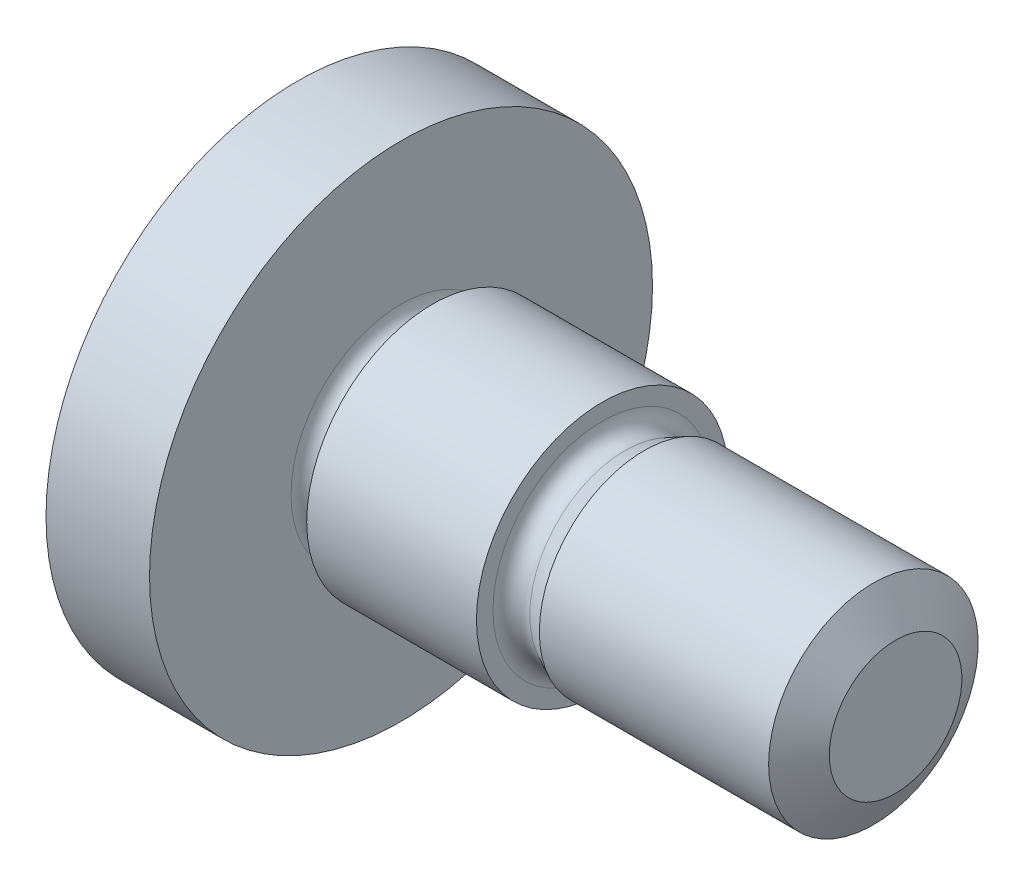
from build123d import *

# Parameters (mm, degrees)
WYTNIJ_WYCI_GNI_CIE1_DEPTH = 3
ZAOKR_GLENIE2_R            = 0.375


with BuildPart() as part:
    # Szkic1 → Obrót1 (revolve)
    with BuildSketch(Plane.XY, mode=Mode.PRIVATE) as obr_t1_sk:
        Polygon((0, 0), (0, 5.082013072), (0.53, 6), (3, 6), (3, 2.25), (3.75, 2.25), (3.75, 3), (7.8, 3), (7.8, 2), (8.8, 2.5), (14.27, 2.5), (14.8, 1.582013072), (14.8, 0), align=None)
    revolve(obr_t1_sk.sketch.rotate(Axis((0, 0, 0), (1, 0, 0)), 90), axis=Axis((0, 0, 0), (1, 0, 0)))

    # Szkic2 → Wytnij-wyciągnięcie1 (cut)
    with BuildSketch(Plane.ZY):
        Polygon((0, -1.732050808), (1.5, -0.866025404), (1.5, 0.866025404), (0, 1.732050808), (-1.5, 0.866025404), (-1.5, -0.866025404), align=None)
    extrude(amount=-WYTNIJ_WYCI_GNI_CIE1_DEPTH, mode=Mode.SUBTRACT)

    # Szkic3 → Wycięcie-obrót1 (revolve, cut)
    with BuildSketch(Plane.XY, mode=Mode.PRIVATE) as wyci_cie_obr_t1_sk:
        Polygon((3, 0), (3, 1.732050808), (3.807668556, 0), align=None)
    revolve(wyci_cie_obr_t1_sk.sketch.rotate(Axis((-0.90277096, 0, 0), (1, 0, 0)), 90), axis=Axis((-0.90277096, 0, 0), (1, 0, 0)), mode=Mode.SUBTRACT)

    # Zaokrąglenie2
    zaokr_glenie2_edges = [part.edges().sort_by_distance(p)[0] for p in [
        (7.8, 0, -2),
        (3.75, 0, -2.25),
        (3, 0, -2.25),
    ]]
    fillet(zaokr_glenie2_edges, radius=ZAOKR_GLENIE2_R - 0.0001)  # a hair under: the kernel refuses the full size


solid = part.part
